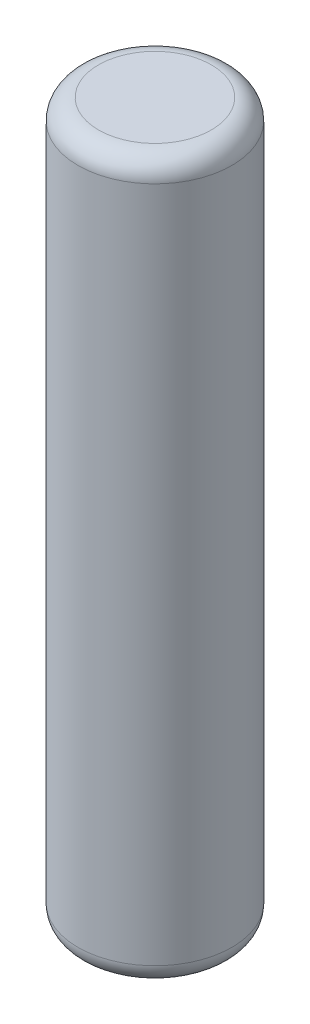
from build123d import *

# Parameters (mm, degrees)
SKETCH_1_R      = 0.375
EXTRUDE_1_DEPTH = 3.5
FILLET_1_R      = 0.1


with BuildPart() as part:
    # Эскиз1 → Бобышка-Вытянуть1 (new body)
    with BuildSketch(Plane(origin=(0, 0, 0), x_dir=(1, 0, 0), z_dir=(0, 1, 0))):
        Circle(SKETCH_1_R)
    extrude(amount=EXTRUDE_1_DEPTH)

    # Скругление1
    fillet_1_edges = [part.edges().sort_by_distance(p)[0] for p in [
        (-0.375, 0, 0),
        (-0.375, 3.5, 0),
    ]]
    fillet(fillet_1_edges, radius=FILLET_1_R)


solid = part.part
